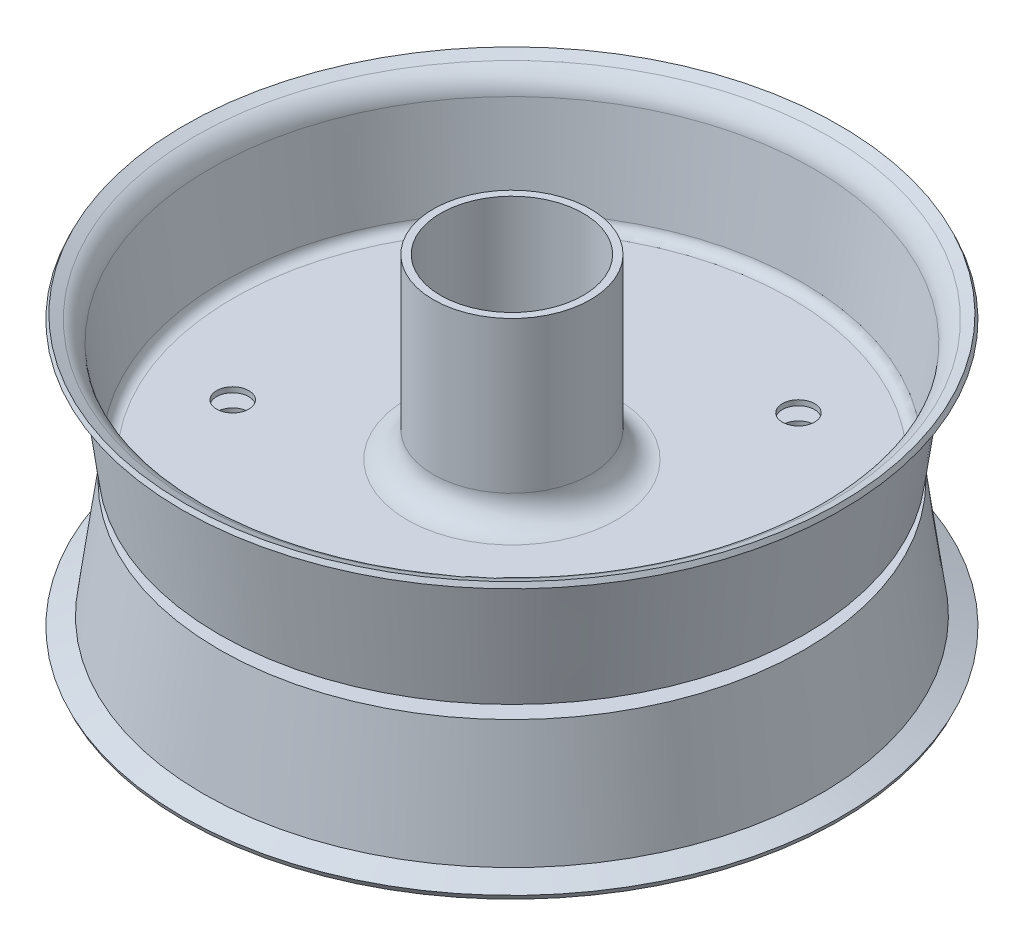
from build123d import *

# Parameters (mm, degrees)
SKETCH1_R            = 19.05
SKETCH1_R_2          = 17.272
BOSS_EXTRUDE1_DEPTH  = 73.152
FILLET1_R            = 6.35
FILLET2_R            = 2.54
FILLET3_R            = 6.35
CUT_EXTRUDE1_REACH   = 122.908
SKETCH2_R            = 3.9
FILLET1_OF_MIRROR1_R = 6.35
FILLET2_OF_MIRROR1_R = 2.54
FILLET3_OF_MIRROR1_R = 6.35


with BuildPart() as part:
    # Sketch1 → Boss-Extrude1 (new body)
    with BuildSketch(Plane(origin=(0, 0, 0), x_dir=(1, 0, 0), z_dir=(0, 1, 0))):
        Circle(SKETCH1_R)
        Circle(SKETCH1_R_2, mode=Mode.SUBTRACT)
    extrude(amount=BOSS_EXTRUDE1_DEPTH)

    # Sketch3 → Revolve1 (revolve)
    with BuildSketch(Plane(origin=(0, 0, 0), x_dir=(0, 0, -1), z_dir=(1, 0, 0))):
        Polygon((-19.05, 30.099), (-69.85, 30.099), (-73.66, 58.039), (-79.375, 60.579), (-79.890795852, 59.418459333), (-74.822704503, 57.165974289), (-70.958571646, 28.829), (-19.05, 28.829), align=None)
    revolve1 = revolve(axis=Axis((0, 73.152, 0), (0, -1, 0)))

    # Fillet1
    fillet1_edges = [part.edges().sort_by_distance(p)[0] for p in [
        (-19.05, 30.099, 0),
    ]]
    fillet(fillet1_edges, radius=FILLET1_R)

    # Fillet2
    fillet2_edges = [part.edges().sort_by_distance(p)[0] for p in [
        (0, 30.099, -69.85),
    ]]
    fillet(fillet2_edges, radius=FILLET2_R)

    # Fillet3
    fillet3_edges = [part.edges().sort_by_distance(p)[0] for p in [
        (0, 58.039, -73.66),
    ]]
    fillet(fillet3_edges, radius=FILLET3_R)

    # Sketch2 → Cut-Extrude1 (cut, up to next)
    with BuildSketch(Plane(origin=(0, 30.099, 0), x_dir=(1, 0, 0), z_dir=(0, 1, 0)), mode=Mode.PRIVATE) as cut_extrude1_sk1:
        with Locations((-34.614825389, 37.48444822)):
            Circle(SKETCH2_R)
    cut_extrude1_tool1 = extrude(cut_extrude1_sk1.sketch, amount=-CUT_EXTRUDE1_REACH, mode=Mode.PRIVATE) & part.part
    # Sketch2 → Cut-Extrude1 (cut, up to next)
    with BuildSketch(Plane(origin=(0, 30.099, 0), x_dir=(1, 0, 0), z_dir=(0, 1, 0)), mode=Mode.PRIVATE) as cut_extrude1_sk2:
        with Locations((24.953259436, 44.503986772)):
            Circle(SKETCH2_R)
    cut_extrude1_tool2 = extrude(cut_extrude1_sk2.sketch, amount=-CUT_EXTRUDE1_REACH, mode=Mode.PRIVATE) & part.part
    # Sketch2 → Cut-Extrude1 (cut, up to next)
    with BuildSketch(Plane(origin=(0, 30.099, 0), x_dir=(1, 0, 0), z_dir=(0, 1, 0)), mode=Mode.PRIVATE) as cut_extrude1_sk3:
        with Locations((50.036787851, -9.97947176)):
            Circle(SKETCH2_R)
    cut_extrude1_tool3 = extrude(cut_extrude1_sk3.sketch, amount=-CUT_EXTRUDE1_REACH, mode=Mode.PRIVATE) & part.part
    # Sketch2 → Cut-Extrude1 (cut, up to next)
    with BuildSketch(Plane(origin=(0, 30.099, 0), x_dir=(1, 0, 0), z_dir=(0, 1, 0)), mode=Mode.PRIVATE) as cut_extrude1_sk4:
        with Locations((5.971176144, -50.671639509)):
            Circle(SKETCH2_R)
    cut_extrude1_tool4 = extrude(cut_extrude1_sk4.sketch, amount=-CUT_EXTRUDE1_REACH, mode=Mode.PRIVATE) & part.part
    # Sketch2 → Cut-Extrude1 (cut, up to next)
    with BuildSketch(Plane(origin=(0, 30.099, 0), x_dir=(1, 0, 0), z_dir=(0, 1, 0)), mode=Mode.PRIVATE) as cut_extrude1_sk5:
        with Locations((-46.346398042, -21.337323722)):
            Circle(SKETCH2_R)
    cut_extrude1_tool5 = extrude(cut_extrude1_sk5.sketch, amount=-CUT_EXTRUDE1_REACH, mode=Mode.PRIVATE) & part.part
    cut_extrude1_1 = cut_extrude1_tool1.solids().sort_by_distance((-34.614825, 30.099, -37.484448))[0]
    add(cut_extrude1_1, mode=Mode.SUBTRACT)
    cut_extrude1_2 = cut_extrude1_tool2.solids().sort_by_distance((24.953259, 30.099, -44.503987))[0]
    add(cut_extrude1_2, mode=Mode.SUBTRACT)
    cut_extrude1_3 = cut_extrude1_tool3.solids().sort_by_distance((50.036788, 30.099, 9.979472))[0]
    add(cut_extrude1_3, mode=Mode.SUBTRACT)
    cut_extrude1_4 = cut_extrude1_tool4.solids().sort_by_distance((5.971176, 30.099, 50.67164))[0]
    add(cut_extrude1_4, mode=Mode.SUBTRACT)
    cut_extrude1_5 = cut_extrude1_tool5.solids().sort_by_distance((-46.346398, 30.099, 21.337324))[0]
    add(cut_extrude1_5, mode=Mode.SUBTRACT)
    cut_extrude1 = cut_extrude1_1 + cut_extrude1_2 + cut_extrude1_3 + cut_extrude1_4 + cut_extrude1_5  # Cut-Extrude1 as one shape, for the pattern or mirror that repeats it

    # Mirror1: Revolve1, Cut-Extrude1 across plane
    add(revolve1.mirror(Plane(origin=(0, 27.2415, 0), x_dir=(0, 0, 1), z_dir=(0, -1, 0))))
    add(cut_extrude1.mirror(Plane(origin=(0, 27.2415, 0), x_dir=(0, 0, 1), z_dir=(0, -1, 0))), mode=Mode.SUBTRACT)

    # Fillet1 of Mirror1
    fillet1_of_mirror1_edges = [part.edges().sort_by_distance(p)[0] for p in [
        (-19.05, 24.384, 0),
    ]]
    fillet(fillet1_of_mirror1_edges, radius=FILLET1_OF_MIRROR1_R)

    # Fillet2 of Mirror1
    fillet2_of_mirror1_edges = [part.edges().sort_by_distance(p)[0] for p in [
        (0, 24.384, -69.85),
    ]]
    fillet(fillet2_of_mirror1_edges, radius=FILLET2_OF_MIRROR1_R)

    # Fillet3 of Mirror1
    fillet3_of_mirror1_edges = [part.edges().sort_by_distance(p)[0] for p in [
        (0, -3.556, -73.66),
    ]]
    fillet(fillet3_of_mirror1_edges, radius=FILLET3_OF_MIRROR1_R)


solid = part.part
